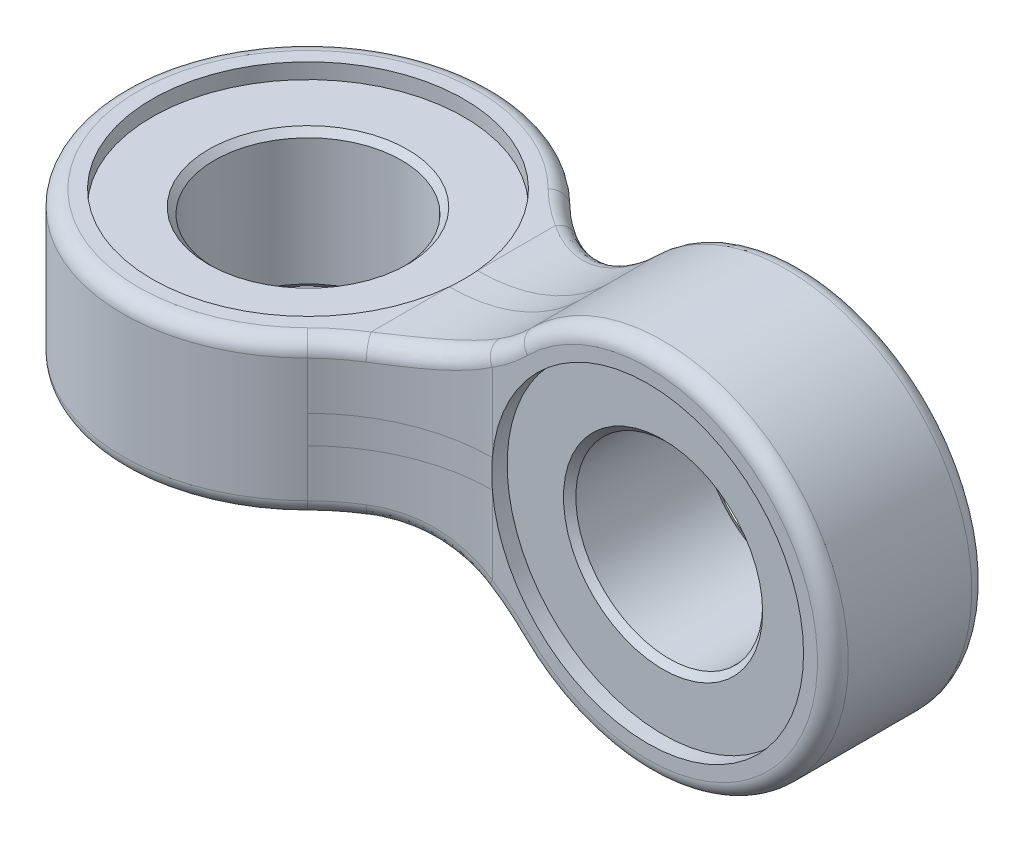
from build123d import *

# Parameters (mm, degrees)
SKETCH1_R               = 3.025
BOSS_EXTRUDE1_DEPTH     = 14.1
CUT_EXTRUDE1_DEPTH      = 26.996345897
CUT_EXTRUDE1_DEPTH_BACK = 26.996345897
SKETCH2_W               = 12
SKETCH2_H               = 4.55
SKETCH3_R               = 3.025
CUT_EXTRUDE2_DEPTH      = 27.684452402
CUT_EXTRUDE3_DEPTH      = 10
SKETCH6_R               = 5.05
CUT_EXTRUDE4_DEPTH      = 0.5
SKETCH7_R               = 5.05
CUT_EXTRUDE5_DEPTH      = 0.5
FILLET1_R               = 6
CHAMFER1_SIZE           = 0.2
FILLET2_R               = 0.5


with BuildPart() as part:
    # Sketch1 → Boss-Extrude1 (new body)
    with BuildSketch(Plane(origin=(0, 0, 0), x_dir=(1, 0, 0), z_dir=(0, 1, 0))):
        with BuildLine():
            Line((21, -2.5), (21, 2.5))
            Line((21, 2.5), (5.454356057, 2.5))
            ThreePointArc((5.454356057, 2.5), (-6, 0), (5.454356057, -2.5))
            Line((5.454356057, -2.5), (21, -2.5))
        make_face()
        Circle(SKETCH1_R, mode=Mode.SUBTRACT)
    extrude(amount=BOSS_EXTRUDE1_DEPTH)

    # Sketch2 → Cut-Extrude1 (cut, two sides: drawn at the far end of the back side and taken through both)
    with BuildSketch(Plane(origin=(0, 0, 0), x_dir=(-1, 0, 0), z_dir=(0, 0, -1)).offset(-CUT_EXTRUDE1_DEPTH_BACK)):
        with Locations((0, 2.275)):
            Rectangle(SKETCH2_W, SKETCH2_H)
        with Locations((0, 11.825)):
            Rectangle(SKETCH2_W, SKETCH2_H)
    extrude(amount=CUT_EXTRUDE1_DEPTH + CUT_EXTRUDE1_DEPTH_BACK, mode=Mode.SUBTRACT)

    # Sketch3 → Cut-Extrude2 (cut, through all)
    with BuildSketch(Plane(origin=(0, 0, -2.5), x_dir=(-1, 0, 0), z_dir=(0, 0, -1))):
        with Locations((-13.5, 7.05)):
            Circle(SKETCH3_R)
    extrude(amount=-CUT_EXTRUDE2_DEPTH, mode=Mode.SUBTRACT)

    # Sketch4 → Cut-Extrude3 (cut)
    with BuildSketch(Plane(origin=(0, 0, -2.5), x_dir=(-1, 0, 0), z_dir=(0, 0, -1))):
        with BuildLine():
            Line((-8.045643943, 9.55), (-6, 9.55))
            Line((-6, 9.55), (-6, 14.1))
            Line((-6, 14.1), (-21, 14.1))
            Line((-21, 14.1), (-21, 0))
            Line((-21, 0), (-6, 0))
            Line((-6, 0), (-6, 4.55))
            Line((-6, 4.55), (-8.045643943, 4.55))
            ThreePointArc((-8.045643943, 4.55), (-19.5, 7.05), (-8.045643943, 9.55))
        make_face()
    extrude(amount=-CUT_EXTRUDE3_DEPTH, mode=Mode.SUBTRACT)

    # Sketch6 → Cut-Extrude4 (cut)
    with BuildSketch(Plane(origin=(0, 9.55, 0), x_dir=(1, 0, 0), z_dir=(0, 1, 0))):
        Circle(SKETCH6_R)
    extrude(amount=-CUT_EXTRUDE4_DEPTH, mode=Mode.SUBTRACT)

    # Sketch7 → Cut-Extrude5 (cut)
    with BuildSketch(Plane.XY.offset(2.5)):
        with Locations((13.5, 7.05)):
            Circle(SKETCH7_R)
    extrude(amount=-CUT_EXTRUDE5_DEPTH, mode=Mode.SUBTRACT)

    # Fillet1
    fillet1_edges = [part.edges().sort_by_distance(p)[0] for p in [
        (5.454356057, 7.05, 2.5),
    ]]
    fillet(fillet1_edges, radius=FILLET1_R)
    fillet1_2_edges = [part.edges().sort_by_distance(p)[0] for p in [
        (8.045643943, 4.55, 0.007531715),
    ]]
    fillet(fillet1_2_edges, radius=FILLET1_R)
    fillet1_3_edges = [part.edges().sort_by_distance(p)[0] for p in [
        (5.454356057, 7.042468285, -2.5),
    ]]
    fillet(fillet1_3_edges, radius=FILLET1_R)
    fillet1_4_edges = [part.edges().sort_by_distance(p)[0] for p in [
        (8.045643943, 9.55, 0),
    ]]
    fillet(fillet1_4_edges, radius=FILLET1_R)

    # Chamfer1
    chamfer1_edges = [part.edges().sort_by_distance(p)[0] for p in [
        (16.525, 7.05, -2.5),
        (-3.025, 4.55, 0),
        (16.525, 7.05, 2),
        (-3.025, 9.05, 0),
    ]]
    chamfer(chamfer1_edges, length=CHAMFER1_SIZE)

    # Fillet2
    fillet2_edges = [part.edges().sort_by_distance(p)[0] for p in [
        (6.75, 9.801978442, 2.751978442),
        (19.5, 7.05, 2.5),
        (6.75, 4.298021558, 2.751978442),
        (-6, 4.55, 0),
        (6.75, 4.298021558, -2.751978442),
        (19.5, 7.05, -2.5),
        (6.75, 9.801978442, -2.751978442),
        (-6, 9.55, 0),
        (4.617982599, 9.55, 3.900236609),
        (4.617982599, 9.55, -3.900236609),
        (8.882017401, 10.950236609, 2.5),
        (8.882017401, 3.149763391, 2.5),
        (4.617982599, 4.55, 3.900236609),
        (4.617982599, 4.55, -3.900236609),
        (8.882017401, 3.149763391, -2.5),
        (8.882017401, 10.950236609, -2.5),
    ]]
    fillet(fillet2_edges, radius=FILLET2_R)


solid = part.part
